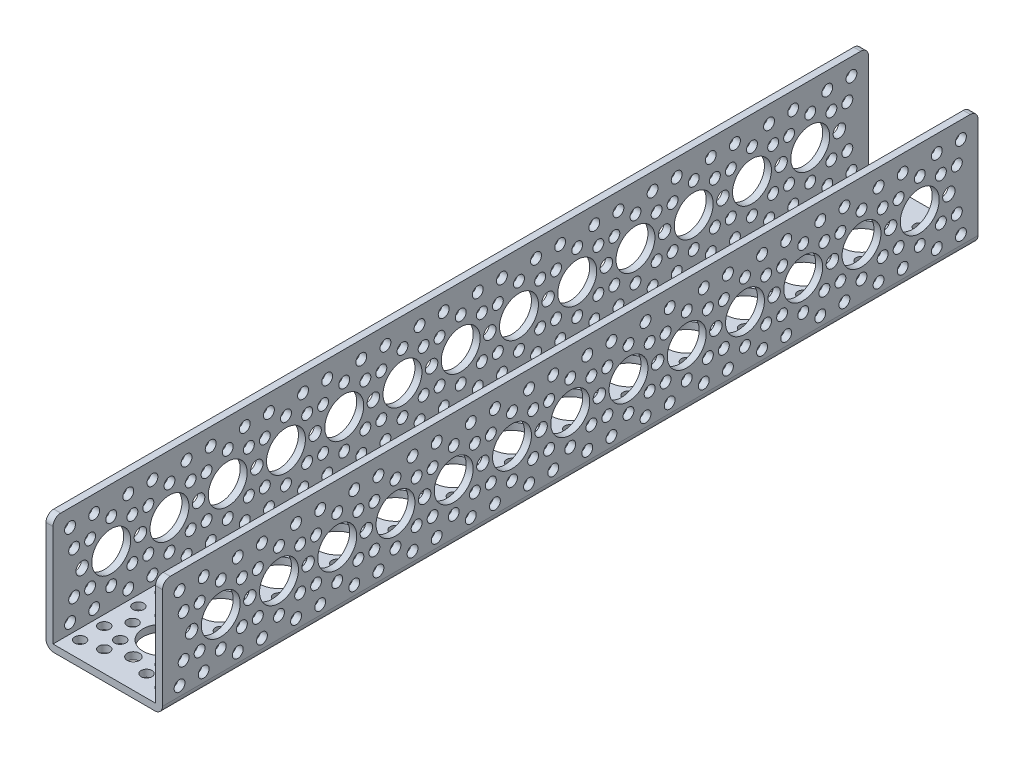
from build123d import *

# Parameters (mm, degrees)
SKETCH1_W                 = 38.1
SKETCH1_H                 = 266.7
BOSS_EXTRUDE1_DEPTH       = 38.1
SKETCH2_W                 = 33.528
SKETCH2_H                 = 35.814
CUT_EXTRUDE1_DEPTH        = 273.088423127
HOLE1_D                   = 12.7254
HOLE1_DEPTH               = 2.286
F_5_CLEARANCE_HOLE1_D     = 3.556
F_5_CLEARANCE_HOLE1_DEPTH = 2.286
F_6_CLEARANCE_HOLE1_D     = 4.064
F_6_CLEARANCE_HOLE1_DEPTH = 2.286
HOLE2_D                   = 12.7254
HOLE2_DEPTH               = 38.1
F_6_CLEARANCE_HOLE2_D     = 4.064
F_6_CLEARANCE_HOLE2_DEPTH = 38.1
F_5_CLEARANCE_HOLE2_D     = 3.556
F_5_CLEARANCE_HOLE2_DEPTH = 38.1
HOLE3_D                   = 12.7254
HOLE3_DEPTH               = 38.1
F_5_CLEARANCE_HOLE3_D     = 3.556
F_5_CLEARANCE_HOLE3_DEPTH = 38.1
F_6_CLEARANCE_HOLE3_D     = 4.064
F_6_CLEARANCE_HOLE3_DEPTH = 38.1
FILLET1_R                 = 2.54


with BuildPart() as part:
    # Sketch1 → Boss-Extrude1 (new body)
    with BuildSketch(Plane.XZ):
        with Locations((19.05, 133.35)):
            Rectangle(SKETCH1_W, SKETCH1_H)
    extrude(amount=-BOSS_EXTRUDE1_DEPTH)

    # Sketch2 → Cut-Extrude1 (cut, through all)
    with BuildSketch(Plane.XY.offset(266.7)):
        with Locations((19.05, 20.193)):
            Rectangle(SKETCH2_W, SKETCH2_H)
    extrude(amount=-CUT_EXTRUDE1_DEPTH, mode=Mode.SUBTRACT)

    # Hole1
    with Locations(Plane(origin=(38.1, 0, 0), x_dir=(0, 0, -1), z_dir=(1, 0, 0))):
        with Locations((-38.1, 19.05), (-19.05, 19.05), (-57.15, 19.05), (-76.2, 19.05), (-95.25, 19.05), (-114.3, 19.05), (-133.35, 19.05), (-152.4, 19.05), (-171.45, 19.05), (-190.5, 19.05), (-209.55, 19.05), (-228.6, 19.05), (-247.65, 19.05)):
            Hole(HOLE1_D / 2, depth=HOLE1_DEPTH)

    # #5 Clearance Hole1
    with Locations(Plane(origin=(38.1, 0, 0), x_dir=(0, 0, -1), z_dir=(1, 0, 0))):
        with Locations((-253.229615818, 5.579615818), (-259.785202787, 12.135202787), (-253.229615818, 32.520384182), (-259.785202787, 25.964797213), (-13.470384182, 5.579615818), (-6.914797213, 12.135202787), (-13.470384182, 32.520384182), (-6.914797213, 25.964797213), (-234.179615818, 5.579615818), (-215.129615818, 5.579615818), (-196.079615818, 5.579615818), (-177.029615818, 5.579615818), (-157.979615818, 5.579615818), (-138.929615818, 5.579615818), (-119.879615818, 5.579615818), (-100.829615818, 5.579615818), (-81.779615818, 5.579615818), (-62.729615818, 5.579615818), (-43.679615818, 5.579615818), (-24.629615818, 5.579615818), (-234.179615818, 32.520384182), (-215.129615818, 32.520384182), (-196.079615818, 32.520384182), (-177.029615818, 32.520384182), (-157.979615818, 32.520384182), (-138.929615818, 32.520384182), (-119.879615818, 32.520384182), (-100.829615818, 32.520384182), (-81.779615818, 32.520384182), (-62.729615818, 32.520384182), (-43.679615818, 32.520384182), (-24.629615818, 32.520384182), (-261.120384182, 5.579615818), (-261.120384182, 32.520384182), (-242.070384182, 5.579615818), (-242.070384182, 32.520384182), (-223.020384182, 5.579615818), (-223.020384182, 32.520384182), (-203.970384182, 5.579615818), (-203.970384182, 32.520384182), (-184.920384182, 5.579615818), (-184.920384182, 32.520384182), (-165.870384182, 5.579615818), (-165.870384182, 32.520384182), (-146.820384182, 5.579615818), (-146.820384182, 32.520384182), (-127.770384182, 5.579615818), (-127.770384182, 32.520384182), (-108.720384182, 5.579615818), (-108.720384182, 32.520384182), (-89.670384182, 5.579615818), (-89.670384182, 32.520384182), (-70.620384182, 5.579615818), (-70.620384182, 32.520384182), (-51.570384182, 5.579615818), (-51.570384182, 32.520384182), (-240.735202787, 12.135202787), (-247.65, 9.271), (-254.564797213, 12.135202787), (-254.564797213, 25.964797213), (-247.65, 28.829), (-221.685202787, 12.135202787), (-228.6, 9.271), (-235.514797213, 12.135202787), (-235.514797213, 25.964797213), (-228.6, 28.829), (-202.635202787, 12.135202787), (-209.55, 9.271), (-216.464797213, 12.135202787), (-216.464797213, 25.964797213), (-209.55, 28.829), (-183.585202787, 12.135202787), (-190.5, 9.271), (-197.414797213, 12.135202787), (-197.414797213, 25.964797213), (-190.5, 28.829), (-164.535202787, 12.135202787), (-171.45, 9.271), (-178.364797213, 12.135202787), (-178.364797213, 25.964797213), (-171.45, 28.829), (-145.485202787, 12.135202787), (-152.4, 9.271), (-159.314797213, 12.135202787), (-159.314797213, 25.964797213), (-152.4, 28.829), (-126.435202787, 12.135202787), (-133.35, 9.271), (-140.264797213, 12.135202787), (-140.264797213, 25.964797213), (-133.35, 28.829), (-107.385202787, 12.135202787), (-114.3, 9.271), (-121.214797213, 12.135202787), (-121.214797213, 25.964797213), (-114.3, 28.829), (-88.335202787, 12.135202787), (-95.25, 9.271), (-102.164797213, 12.135202787), (-102.164797213, 25.964797213), (-95.25, 28.829), (-69.285202787, 12.135202787), (-76.2, 9.271), (-83.114797213, 12.135202787), (-83.114797213, 25.964797213), (-76.2, 28.829), (-50.235202787, 12.135202787), (-57.15, 9.271), (-64.064797213, 12.135202787), (-64.064797213, 25.964797213), (-57.15, 28.829), (-31.185202787, 12.135202787), (-38.1, 9.271), (-45.014797213, 12.135202787), (-45.014797213, 25.964797213), (-38.1, 28.829), (-240.735202787, 25.964797213), (-221.685202787, 25.964797213), (-202.635202787, 25.964797213), (-183.585202787, 25.964797213), (-164.535202787, 25.964797213), (-145.485202787, 25.964797213), (-126.435202787, 25.964797213), (-107.385202787, 25.964797213), (-88.335202787, 25.964797213), (-69.285202787, 25.964797213), (-50.235202787, 25.964797213), (-31.185202787, 25.964797213), (-32.520384182, 5.579615818), (-32.520384182, 32.520384182), (-5.579615818, 5.579615818), (-5.579615818, 32.520384182), (-12.135202787, 12.135202787), (-19.05, 9.271), (-25.964797213, 12.135202787), (-25.964797213, 25.964797213), (-19.05, 28.829), (-12.135202787, 25.964797213)):
            Hole(F_5_CLEARANCE_HOLE1_D / 2, depth=F_5_CLEARANCE_HOLE1_DEPTH)

    # #6 Clearance Hole1
    with Locations(Plane(origin=(38.1, 0, 0), x_dir=(0, 0, -1), z_dir=(1, 0, 0))):
        with Locations((-257.175, 19.05), (-238.125, 19.05), (-219.075, 19.05), (-200.025, 19.05), (-180.975, 19.05), (-161.925, 19.05), (-142.875, 19.05), (-123.825, 19.05), (-104.775, 19.05), (-85.725, 19.05), (-66.675, 19.05), (-47.625, 19.05), (-28.575, 19.05), (-9.525, 19.05)):
            Hole(F_6_CLEARANCE_HOLE1_D / 2, depth=F_6_CLEARANCE_HOLE1_DEPTH)

    # Hole2
    with Locations(Plane(origin=(0, 0, 0), x_dir=(-1, 0, 0), z_dir=(0, -1, 0))):
        with Locations((-19.05, -247.65), (-19.05, -228.6), (-19.05, -209.55), (-19.05, -190.5), (-19.05, -171.45), (-19.05, -152.4), (-19.05, -133.35), (-19.05, -114.3), (-19.05, -95.25), (-19.05, -76.2), (-19.05, -57.15), (-19.05, -38.1), (-19.05, -19.05)):
            Hole(HOLE2_D / 2, depth=HOLE2_DEPTH)

    # #6 Clearance Hole2
    with Locations(Plane(origin=(0, 0, 0), x_dir=(-1, 0, 0), z_dir=(0, -1, 0))):
        with Locations((-19.05, -257.175), (-19.05, -238.125), (-19.05, -219.075), (-19.05, -200.025), (-19.05, -180.975), (-19.05, -161.925), (-19.05, -142.875), (-19.05, -123.825), (-19.05, -104.775), (-19.05, -85.725), (-19.05, -66.675), (-19.05, -47.625), (-19.05, -28.575), (-19.05, -9.525)):
            Hole(F_6_CLEARANCE_HOLE2_D / 2, depth=F_6_CLEARANCE_HOLE2_DEPTH)

    # #5 Clearance Hole2
    with Locations(Plane(origin=(0, 0, 0), x_dir=(-1, 0, 0), z_dir=(0, -1, 0))):
        with Locations((-5.579615818, -261.120384182), (-5.579615818, -253.229615818), (-12.135202787, -259.785202787), (-32.520384182, -261.120384182), (-32.520384182, -253.229615818), (-25.964797213, -259.785202787), (-5.579615818, -242.070384182), (-5.579615818, -234.179615818), (-32.520384182, -242.070384182), (-32.520384182, -234.179615818), (-5.579615818, -223.020384182), (-5.579615818, -215.129615818), (-32.520384182, -223.020384182), (-32.520384182, -215.129615818), (-5.579615818, -203.970384182), (-5.579615818, -196.079615818), (-32.520384182, -203.970384182), (-32.520384182, -196.079615818), (-5.579615818, -184.920384182), (-5.579615818, -177.029615818), (-32.520384182, -184.920384182), (-32.520384182, -177.029615818), (-5.579615818, -165.870384182), (-5.579615818, -157.979615818), (-32.520384182, -165.870384182), (-32.520384182, -157.979615818), (-5.579615818, -146.820384182), (-5.579615818, -138.929615818), (-32.520384182, -146.820384182), (-32.520384182, -138.929615818), (-5.579615818, -127.770384182), (-5.579615818, -119.879615818), (-32.520384182, -127.770384182), (-32.520384182, -119.879615818), (-5.579615818, -108.720384182), (-5.579615818, -100.829615818), (-32.520384182, -108.720384182), (-32.520384182, -100.829615818), (-5.579615818, -89.670384182), (-5.579615818, -81.779615818), (-32.520384182, -89.670384182), (-32.520384182, -81.779615818), (-5.579615818, -70.620384182), (-5.579615818, -62.729615818), (-32.520384182, -70.620384182), (-32.520384182, -62.729615818), (-5.579615818, -51.570384182), (-5.579615818, -43.679615818), (-32.520384182, -51.570384182), (-32.520384182, -43.679615818), (-12.135202787, -240.735202787), (-9.271, -247.65), (-12.135202787, -254.564797213), (-25.964797213, -254.564797213), (-28.829, -247.65), (-25.964797213, -240.735202787), (-12.135202787, -221.685202787), (-9.271, -228.6), (-12.135202787, -235.514797213), (-25.964797213, -235.514797213), (-28.829, -228.6), (-25.964797213, -221.685202787), (-12.135202787, -202.635202787), (-9.271, -209.55), (-12.135202787, -216.464797213), (-25.964797213, -216.464797213), (-28.829, -209.55), (-25.964797213, -202.635202787), (-12.135202787, -183.585202787), (-9.271, -190.5), (-12.135202787, -197.414797213), (-25.964797213, -197.414797213), (-28.829, -190.5), (-25.964797213, -183.585202787), (-12.135202787, -164.535202787), (-9.271, -171.45), (-12.135202787, -178.364797213), (-25.964797213, -178.364797213), (-28.829, -171.45), (-25.964797213, -164.535202787), (-12.135202787, -145.485202787), (-9.271, -152.4), (-12.135202787, -159.314797213), (-25.964797213, -159.314797213), (-28.829, -152.4), (-25.964797213, -145.485202787), (-12.135202787, -126.435202787), (-9.271, -133.35), (-12.135202787, -140.264797213), (-25.964797213, -140.264797213), (-28.829, -133.35), (-25.964797213, -126.435202787), (-12.135202787, -107.385202787), (-9.271, -114.3), (-12.135202787, -121.214797213), (-25.964797213, -121.214797213), (-28.829, -114.3), (-25.964797213, -107.385202787), (-12.135202787, -88.335202787), (-9.271, -95.25), (-12.135202787, -102.164797213), (-25.964797213, -102.164797213), (-28.829, -95.25), (-25.964797213, -88.335202787), (-12.135202787, -69.285202787), (-9.271, -76.2), (-12.135202787, -83.114797213), (-25.964797213, -83.114797213), (-28.829, -76.2), (-25.964797213, -69.285202787), (-12.135202787, -50.235202787), (-9.271, -57.15), (-12.135202787, -64.064797213), (-25.964797213, -64.064797213), (-28.829, -57.15), (-25.964797213, -50.235202787), (-9.271, -38.1), (-12.135202787, -45.014797213), (-25.964797213, -45.014797213), (-28.829, -38.1), (-5.579615818, -32.520384182), (-5.579615818, -24.629615818), (-12.135202787, -31.185202787), (-32.520384182, -32.520384182), (-32.520384182, -24.629615818), (-25.964797213, -31.185202787), (-5.579615818, -5.579615818), (-5.579615818, -13.470384182), (-12.135202787, -6.914797213), (-32.520384182, -5.579615818), (-32.520384182, -13.470384182), (-25.964797213, -6.914797213), (-12.135202787, -12.135202787), (-9.271, -19.05), (-12.135202787, -25.964797213), (-25.964797213, -25.964797213), (-28.829, -19.05), (-25.964797213, -12.135202787)):
            Hole(F_5_CLEARANCE_HOLE2_D / 2, depth=F_5_CLEARANCE_HOLE2_DEPTH)

    # Hole3
    with Locations(Plane.ZY):
        with Locations((38.1, 19.05), (19.05, 19.05), (57.15, 19.05), (76.2, 19.05), (95.25, 19.05), (114.3, 19.05), (133.35, 19.05), (152.4, 19.05), (171.45, 19.05), (190.5, 19.05), (209.55, 19.05), (228.6, 19.05), (247.65, 19.05)):
            Hole(HOLE3_D / 2, depth=HOLE3_DEPTH)

    # #5 Clearance Hole3
    with Locations(Plane.ZY):
        with Locations((253.229615818, 5.579615818), (259.785202787, 12.135202787), (253.229615818, 32.520384182), (259.785202787, 25.964797213), (13.470384182, 5.579615818), (6.914797213, 12.135202787), (13.470384182, 32.520384182), (6.914797213, 25.964797213), (234.179615818, 5.579615818), (215.129615818, 5.579615818), (196.079615818, 5.579615818), (177.029615818, 5.579615818), (157.979615818, 5.579615818), (138.929615818, 5.579615818), (119.879615818, 5.579615818), (100.829615818, 5.579615818), (81.779615818, 5.579615818), (62.729615818, 5.579615818), (43.679615818, 5.579615818), (24.629615818, 5.579615818), (234.179615818, 32.520384182), (215.129615818, 32.520384182), (196.079615818, 32.520384182), (177.029615818, 32.520384182), (157.979615818, 32.520384182), (138.929615818, 32.520384182), (119.879615818, 32.520384182), (100.829615818, 32.520384182), (81.779615818, 32.520384182), (62.729615818, 32.520384182), (43.679615818, 32.520384182), (24.629615818, 32.520384182), (261.120384182, 5.579615818), (261.120384182, 32.520384182), (242.070384182, 5.579615818), (242.070384182, 32.520384182), (223.020384182, 5.579615818), (223.020384182, 32.520384182), (203.970384182, 5.579615818), (203.970384182, 32.520384182), (184.920384182, 5.579615818), (184.920384182, 32.520384182), (165.870384182, 5.579615818), (165.870384182, 32.520384182), (146.820384182, 5.579615818), (146.820384182, 32.520384182), (127.770384182, 5.579615818), (127.770384182, 32.520384182), (108.720384182, 5.579615818), (108.720384182, 32.520384182), (89.670384182, 5.579615818), (89.670384182, 32.520384182), (70.620384182, 5.579615818), (70.620384182, 32.520384182), (51.570384182, 5.579615818), (51.570384182, 32.520384182), (240.735202787, 12.135202787), (247.65, 9.271), (254.564797213, 12.135202787), (254.564797213, 25.964797213), (247.65, 28.829), (221.685202787, 12.135202787), (228.6, 9.271), (235.514797213, 12.135202787), (235.514797213, 25.964797213), (228.6, 28.829), (202.635202787, 12.135202787), (209.55, 9.271), (216.464797213, 12.135202787), (216.464797213, 25.964797213), (209.55, 28.829), (183.585202787, 12.135202787), (190.5, 9.271), (197.414797213, 12.135202787), (197.414797213, 25.964797213), (190.5, 28.829), (164.535202787, 12.135202787), (171.45, 9.271), (178.364797213, 12.135202787), (178.364797213, 25.964797213), (171.45, 28.829), (145.485202787, 12.135202787), (152.4, 9.271), (159.314797213, 12.135202787), (159.314797213, 25.964797213), (152.4, 28.829), (126.435202787, 12.135202787), (133.35, 9.271), (140.264797213, 12.135202787), (140.264797213, 25.964797213), (133.35, 28.829), (107.385202787, 12.135202787), (114.3, 9.271), (121.214797213, 12.135202787), (121.214797213, 25.964797213), (114.3, 28.829), (88.335202787, 12.135202787), (95.25, 9.271), (102.164797213, 12.135202787), (102.164797213, 25.964797213), (95.25, 28.829), (69.285202787, 12.135202787), (76.2, 9.271), (83.114797213, 12.135202787), (83.114797213, 25.964797213), (76.2, 28.829), (50.235202787, 12.135202787), (57.15, 9.271), (64.064797213, 12.135202787), (64.064797213, 25.964797213), (57.15, 28.829), (31.185202787, 12.135202787), (38.1, 9.271), (45.014797213, 12.135202787), (45.014797213, 25.964797213), (38.1, 28.829), (240.735202787, 25.964797213), (221.685202787, 25.964797213), (202.635202787, 25.964797213), (183.585202787, 25.964797213), (164.535202787, 25.964797213), (145.485202787, 25.964797213), (126.435202787, 25.964797213), (107.385202787, 25.964797213), (88.335202787, 25.964797213), (69.285202787, 25.964797213), (50.235202787, 25.964797213), (31.185202787, 25.964797213), (32.520384182, 5.579615818), (32.520384182, 32.520384182), (5.579615818, 5.579615818), (5.579615818, 32.520384182), (12.135202787, 12.135202787), (19.05, 9.271), (25.964797213, 12.135202787), (25.964797213, 25.964797213), (19.05, 28.829), (12.135202787, 25.964797213)):
            Hole(F_5_CLEARANCE_HOLE3_D / 2, depth=F_5_CLEARANCE_HOLE3_DEPTH)

    # #6 Clearance Hole3
    with Locations(Plane.ZY):
        with Locations((257.175, 19.05), (238.125, 19.05), (219.075, 19.05), (200.025, 19.05), (180.975, 19.05), (161.925, 19.05), (142.875, 19.05), (123.825, 19.05), (104.775, 19.05), (85.725, 19.05), (66.675, 19.05), (47.625, 19.05), (28.575, 19.05), (9.525, 19.05)):
            Hole(F_6_CLEARANCE_HOLE3_D / 2, depth=F_6_CLEARANCE_HOLE3_DEPTH)

    # Fillet1
    fillet1_edges = [part.edges().sort_by_distance(p)[0] for p in [
        (1.143, 38.1, 266.7),
        (36.957, 38.1, 266.7),
        (36.957, 38.1, 0),
        (38.1, 0, 133.35),
        (1.143, 38.1, 0),
        (0, 0, 133.35),
    ]]
    fillet(fillet1_edges, radius=FILLET1_R)


solid = part.part
